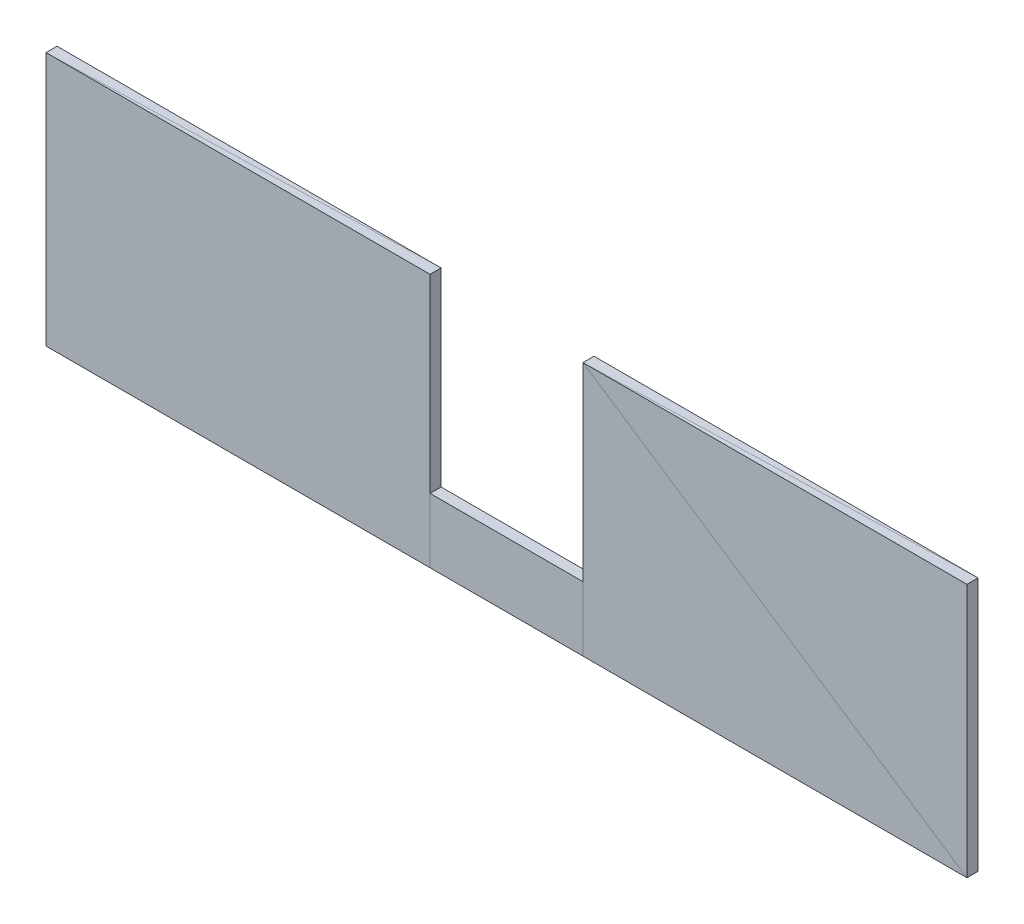
from build123d import *

# Parameters (mm, degrees)
SKETCH1_W           = 1000
SKETCH1_H           = 276
BOSS_EXTRUDE1_DEPTH = 12
CUT_EXTRUDE1_REACH  = 1039.458
SKETCH2_W           = 166
SKETCH2_H           = 276
SKETCH3_W           = 166
SKETCH3_H           = 70
BOSS_EXTRUDE2_DEPTH = 12
SKETCH5_W           = 417
SKETCH5_H           = 276
BOSS_EXTRUDE3_DEPTH = 12
SKETCH6_W           = 417
SKETCH6_H           = 276
BOSS_EXTRUDE4_DEPTH = 12


with BuildPart() as part:
    # Sketch1 → Boss-Extrude1 (new body)
    with BuildSketch(Plane.XY):
        with Locations((500, 138)):
            Rectangle(SKETCH1_W, SKETCH1_H)
    extrude(amount=BOSS_EXTRUDE1_DEPTH)

    # Sketch2 → Cut-Extrude1 (cut, up to next)
    with BuildSketch(Plane.XY.offset(12), mode=Mode.PRIVATE) as cut_extrude1_sk1:
        with Locations((500, 138)):
            Rectangle(SKETCH2_W, SKETCH2_H)
    cut_extrude1_tool1 = extrude(cut_extrude1_sk1.sketch, amount=-CUT_EXTRUDE1_REACH, mode=Mode.PRIVATE) & part.part
    add(cut_extrude1_tool1.solids().sort_by_distance((500, 138, 12))[0], mode=Mode.SUBTRACT)


with BuildPart() as cut_extrude1_piece_1:
    # of the separate pieces the step leaves, piece 1, a body of its own (cut_extrude1_pieces)
    add(part.part.solids().sort_by_distance((0, 276, 0))[0])


with BuildPart() as cut_extrude1_piece_2:
    # of the separate pieces the step leaves, piece 2, a body of its own (cut_extrude1_pieces)
    add(part.part.solids().sort_by_distance((1000, 276, 0))[0])


with BuildPart() as body_3:
    # Sketch3 → Boss-Extrude2 (new body)
    with BuildSketch(Plane.XY):
        with Locations((500, 35)):
            Rectangle(SKETCH3_W, SKETCH3_H)
    extrude(amount=BOSS_EXTRUDE2_DEPTH)


with BuildPart() as body_4:
    # Sketch5 → Boss-Extrude3 (new body)
    with BuildSketch(Plane.XY):
        with Locations((208.5, 138)):
            Rectangle(SKETCH5_W, SKETCH5_H)
    extrude(amount=BOSS_EXTRUDE3_DEPTH)


with BuildPart() as body_5:
    # Sketch6 → Boss-Extrude4 (new body)
    with BuildSketch(Plane.XY):
        with Locations((791.5, 138)):
            Rectangle(SKETCH6_W, SKETCH6_H)
    extrude(amount=BOSS_EXTRUDE4_DEPTH)


solid = Compound([cut_extrude1_piece_1.part, cut_extrude1_piece_2.part, body_3.part, body_4.part, body_5.part])
